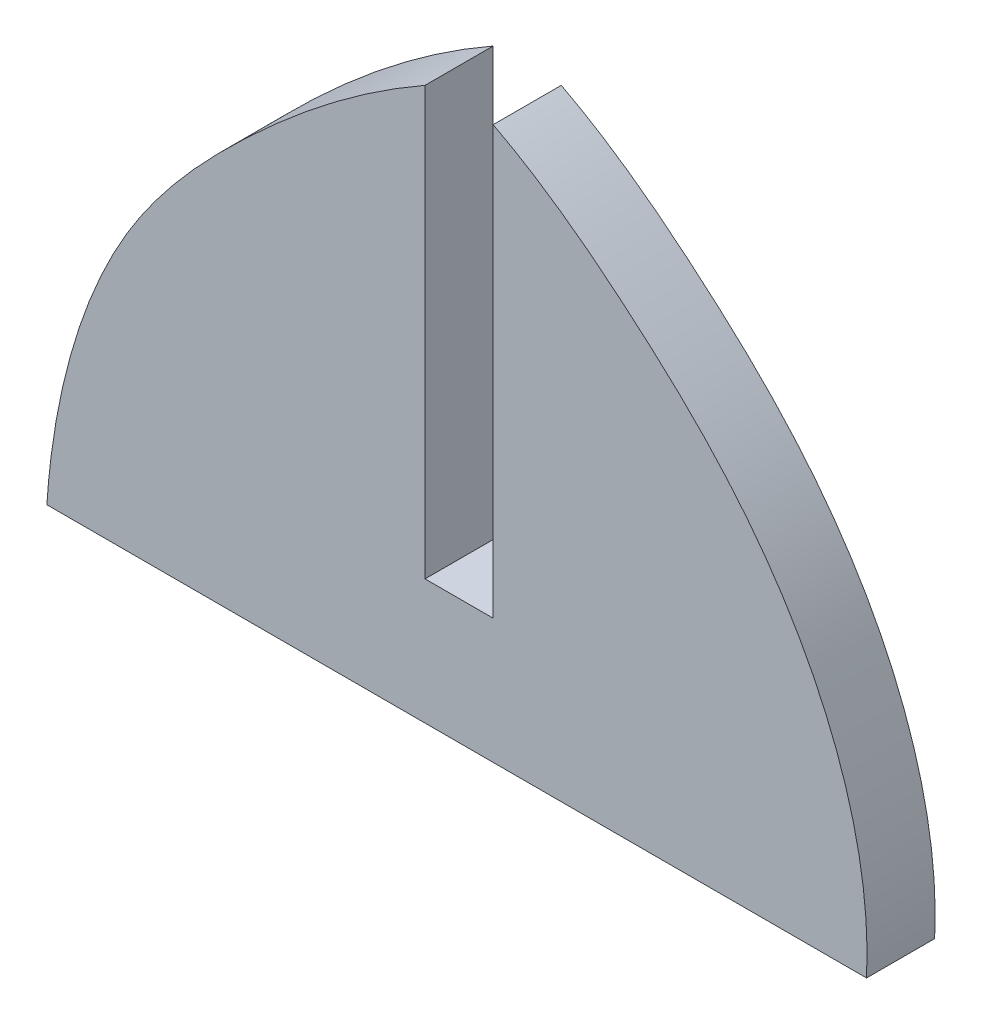
from build123d import *

# Parameters (mm, degrees)
EXTRUDE_1_DEPTH = 8


with BuildPart() as part:
    # 草图1 → 凸台-拉伸1 (new body)
    with BuildSketch(Plane.XY):
        with BuildLine():
            Line((1224.651532178, 227.822926521), (1224.651532178, 177.619186659))
            Line((1224.651532178, 177.619186659), (1232.651532178, 177.619186659))
            Line((1232.651532178, 177.619186659), (1232.651532178, 227.822926521))
            add(Edge.make_bspline(
                [(1232.651532178, 227.822926521), (1238.44149059, 224.813562674), (1248.903452593, 216.928268591), (1268.708754049, 197.972520658), (1277.228004674, 177.354418731), (1276.50807006, 162.95060423)],
                knots=[0, 0, 0, 0, 0.237953219, 0.477618195, 1, 1, 1, 1], degree=3))
            Line((1276.50807006, 162.95060423), (1180.232585387, 162.95060423))
            add(Edge.make_bspline(
                [(1224.651532178, 227.822926521), (1216.778819982, 223.36311268), (1204.532616802, 213.655376106), (1185.849369277, 193.221965523), (1180.992415389, 174.53430299), (1180.232585387, 162.95060423)],
                knots=[0, 0, 0, 0, 0.329523156, 0.570718558, 1, 1, 1, 1], degree=3))
        make_face()
    extrude(amount=EXTRUDE_1_DEPTH)


solid = part.part
